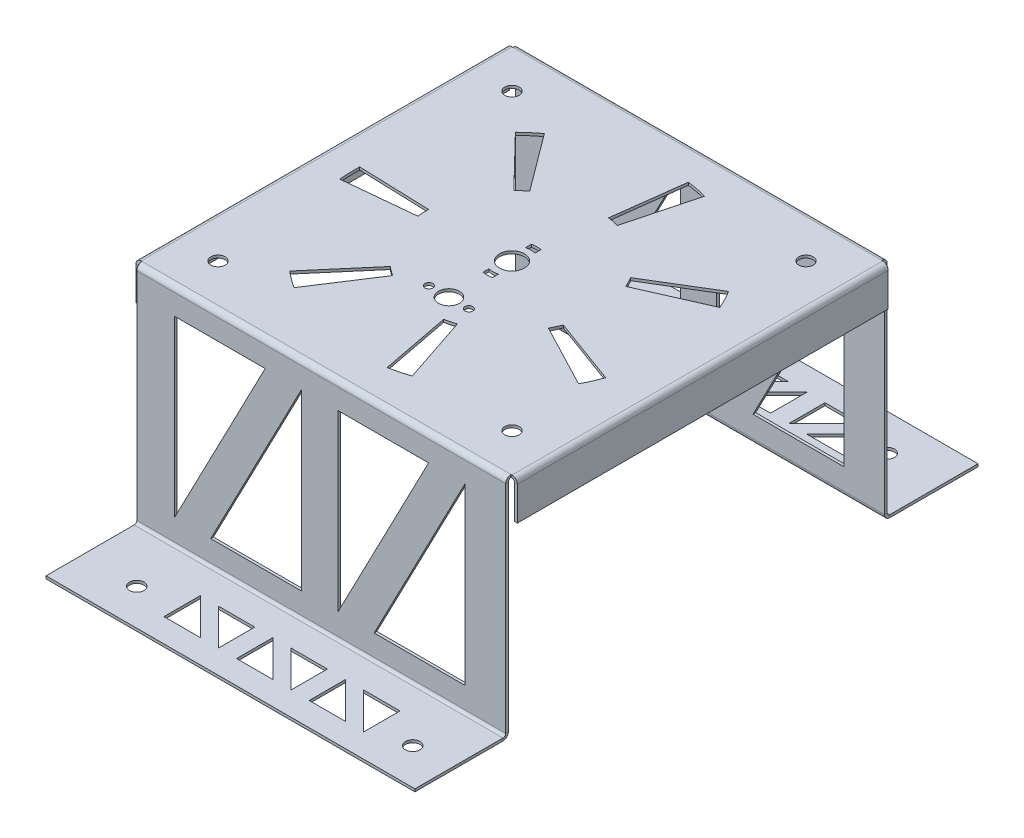
from build123d import *

# Parameters (mm, degrees)
SKETCH1_W                    = 101.6
SKETCH1_H                    = 101.6
BASE_FLANGE1_DEPTH           = 0.7366
EDGE_FLANGE3_DEPTH           = 101.6
EDGE_FLANGE3_BEND_DEPTH      = 101.6
EDGE_FLANGE4_DEPTH           = 102.1268
EDGE_FLANGE4_BEND_DEPTH      = 102.1268
EDGE_FLANGE5_DEPTH           = 101.6
EDGE_FLANGE5_BEND_DEPTH      = 101.6
F_4_0_4_DIAMETER_HOLE1_D     = 4
F_4_0_4_DIAMETER_HOLE1_DEPTH = 15
F_4_0_4_DIAMETER_HOLE1_TIP   = 1.201721238
CUT_EXTRUDE1_DEPTH           = 154.564424318
SKETCH51_R                   = 3.425
CUT_EXTRUDE2_DEPTH           = 174.86951881
CUT_EXTRUDE3_DEPTH           = 10
CUT_EXTRUDE4_DEPTH           = 10
CUT_EXTRUDE9_DEPTH           = 10
CUT_EXTRUDE9_DEPTH_BACK      = 10
SKETCH64_R                   = 1.984375
SKETCH65_R                   = 1.984375
CUT_EXTRUDE10_DEPTH          = 10
CUT_EXTRUDE11_DEPTH          = 172.799608637
CUT_EXTRUDE11_DEPTH_BACK     = 172.799608637
SKETCH66_R                   = 1.984375
CUT_EXTRUDE12_DEPTH          = 172.799608637
CUT_EXTRUDE12_DEPTH_BACK     = 172.799608637
SKETCH67_R                   = 1.984375
SKETCH68_R                   = 2.885
CUT_EXTRUDE13_DEPTH          = 10
SKETCH69_R                   = 1.075
CUT_EXTRUDE14_DEPTH          = 172.529960735
CUT_EXTRUDE20_DEPTH          = 10
CUT_EXTRUDE21_DEPTH          = 10


# Sheet-metal steps are written as plain solids
with BuildPart() as part:
    # Sketch1 → Base-Flange1 (new body)
    with BuildSketch(Plane(origin=(0, 0, 0), x_dir=(1, 0, 0), z_dir=(0, 1, 0))):
        Rectangle(SKETCH1_W, SKETCH1_H)
    extrude(amount=-BASE_FLANGE1_DEPTH)

    # Edge-Flange3 section (across the edge) → Edge-Flange3 (add)
    with BuildSketch(Plane(origin=(50.8, -0.7366, 51.8), x_dir=(0, 0, -1), z_dir=(-1, 0, 0))):
        with BuildLine():
            Line((-0.7366, 0.7366), (-0.7366, 60))
            Line((-0.7366, 60), (0, 60))
            Line((0, 60), (0, 0.7366))
            ThreePointArc((0, 0.7366), (0.215745145, 0.215745145), (0.7366, 0))
            Line((0.7366, 0), (1, 0))
            Line((1, 0), (1, -0.7366))
            Line((1, -0.7366), (0.7366, -0.7366))
            ThreePointArc((0.7366, -0.7366), (-0.30510971, -0.30510971), (-0.7366, 0.7366))
        make_face()
    extrude(amount=EDGE_FLANGE3_DEPTH)

    # Edge-Flange3 section 2 (across the edge) → Edge-Flange3 bend (add)
    with BuildSketch(Plane(origin=(-50.8, -0.7366, -51.8), x_dir=(0, 0, 1), z_dir=(1, 0, 0))):
        with BuildLine():
            Line((-0.7366, 0.7366), (-0.7366, 60))
            Line((-0.7366, 60), (0, 60))
            Line((0, 60), (0, 0.7366))
            ThreePointArc((0, 0.7366), (0.215745145, 0.215745145), (0.7366, 0))
            Line((0.7366, 0), (1, 0))
            Line((1, 0), (1, -0.7366))
            Line((1, -0.7366), (0.7366, -0.7366))
            ThreePointArc((0.7366, -0.7366), (-0.30510971, -0.30510971), (-0.7366, 0.7366))
        make_face()
    extrude(amount=EDGE_FLANGE3_BEND_DEPTH)

    # Edge-Flange4 section (across the edge) → Edge-Flange4 (add)
    with BuildSketch(Plane(origin=(51.8, -0.7366, -51.0634), x_dir=(-1, 0, 0), z_dir=(0, 0, 1))):
        with BuildLine():
            Line((-0.7366, 0.7366), (-0.7366, 10))
            Line((-0.7366, 10), (0, 10))
            Line((0, 10), (0, 0.7366))
            ThreePointArc((0, 0.7366), (0.215745145, 0.215745145), (0.7366, 0))
            Line((0.7366, 0), (1, 0))
            Line((1, 0), (1, -0.7366))
            Line((1, -0.7366), (0.7366, -0.7366))
            ThreePointArc((0.7366, -0.7366), (-0.30510971, -0.30510971), (-0.7366, 0.7366))
        make_face()
    extrude(amount=EDGE_FLANGE4_DEPTH)

    # Edge-Flange4 section 2 (across the edge) → Edge-Flange4 bend (add)
    with BuildSketch(Plane(origin=(-51.8, -0.7366, 51.0634), x_dir=(1, 0, 0), z_dir=(0, 0, -1))):
        with BuildLine():
            Line((-0.7366, 0.7366), (-0.7366, 10))
            Line((-0.7366, 10), (0, 10))
            Line((0, 10), (0, 0.7366))
            ThreePointArc((0, 0.7366), (0.215745145, 0.215745145), (0.7366, 0))
            Line((0.7366, 0), (1, 0))
            Line((1, 0), (1, -0.7366))
            Line((1, -0.7366), (0.7366, -0.7366))
            ThreePointArc((0.7366, -0.7366), (-0.30510971, -0.30510971), (-0.7366, 0.7366))
        make_face()
    extrude(amount=EDGE_FLANGE4_BEND_DEPTH)

    # Edge-Flange5 section (across the edge) → Edge-Flange5 (add)
    with BuildSketch(Plane(origin=(-50.8, -61.7366, 52.5366), x_dir=(0, 1, 0), z_dir=(1, 0, 0))):
        with BuildLine():
            Line((-0.7366, 0.7366), (-0.7366, 25))
            Line((-0.7366, 25), (0, 25))
            Line((0, 25), (0, 0.7366))
            ThreePointArc((0, 0.7366), (0.215745145, 0.215745145), (0.7366, 0))
            Line((0.7366, 0), (1, 0))
            Line((1, 0), (1, -0.7366))
            Line((1, -0.7366), (0.7366, -0.7366))
            ThreePointArc((0.7366, -0.7366), (-0.30510971, -0.30510971), (-0.7366, 0.7366))
        make_face()
    extrude(amount=EDGE_FLANGE5_DEPTH)

    # Edge-Flange5 section 2 (across the edge) → Edge-Flange5 bend (add)
    with BuildSketch(Plane(origin=(50.8, -61.7366, -52.5366), x_dir=(0, 1, 0), z_dir=(-1, 0, 0))):
        with BuildLine():
            Line((-0.7366, 0.7366), (-0.7366, 25))
            Line((-0.7366, 25), (0, 25))
            Line((0, 25), (0, 0.7366))
            ThreePointArc((0, 0.7366), (0.215745145, 0.215745145), (0.7366, 0))
            Line((0.7366, 0), (1, 0))
            Line((1, 0), (1, -0.7366))
            Line((1, -0.7366), (0.7366, -0.7366))
            ThreePointArc((0.7366, -0.7366), (-0.30510971, -0.30510971), (-0.7366, 0.7366))
        make_face()
    extrude(amount=EDGE_FLANGE5_BEND_DEPTH)

    # Ø4.0 (4) Diameter Hole1
    with Locations(Plane(origin=(0, -61.7366, 0), x_dir=(1, 0, 0), z_dir=(0, 1, 0))):
        with Locations((-35.8, 67.5366), (35.8, 67.5366), (-35.8, -67.5366), (40.197040818, -67.5366)):
            Hole(F_4_0_4_DIAMETER_HOLE1_D / 2, depth=F_4_0_4_DIAMETER_HOLE1_DEPTH)
            with Locations((0, 0, -(F_4_0_4_DIAMETER_HOLE1_DEPTH + F_4_0_4_DIAMETER_HOLE1_TIP / 2))):  # 118° drill point
                Cone(0, F_4_0_4_DIAMETER_HOLE1_D / 2, F_4_0_4_DIAMETER_HOLE1_TIP, mode=Mode.SUBTRACT)

    # Sketch50 → Cut-Extrude1 (cut, through all)
    with BuildSketch(Plane(origin=(0, 0, -52.5366), x_dir=(-1, 0, 0), z_dir=(0, 0, -1))):
        Polygon((-14.5721255, -55.172899428), (-39.5721255, -7.116778478), (-39.5721255, -55.172899428), align=None)
        Polygon((-4.5721255, -7.116778478), (-29.5721255, -7.116778478), (-4.5721255, -55.172899428), align=None)
        Polygon((30.4278745, -55.172899428), (5.4278745, -7.116778478), (5.4278745, -55.172899428), align=None)
        Polygon((40.4278745, -7.116778478), (15.4278745, -7.116778478), (40.4278745, -55.172899428), align=None)
    extrude(amount=-CUT_EXTRUDE1_DEPTH, mode=Mode.SUBTRACT)

    # Sketch51 → Cut-Extrude2 (cut, through all)
    with BuildSketch(Plane(origin=(64.672196899, 6.1634, -31.00705316), x_dir=(1, 0, 0), z_dir=(0, 1, 0))):
        with Locations(Location((-64.672196899, -31.00705316, 0), (0, 0, 90))):
            Circle(SKETCH51_R)
    extrude(amount=-CUT_EXTRUDE2_DEPTH, mode=Mode.SUBTRACT)

    # Sketch52 → Cut-Extrude3 (cut)
    with BuildSketch(Plane(origin=(64.672196899, 0.2634, -31.00705316), x_dir=(1, 0, 0), z_dir=(0, 1, 0))):
        with BuildLine():
            Line((-63.372196899, -25.97217481), (-63.372196899, -24.332474521))
            ThreePointArc((-63.372196899, -24.332474521), (-64.672196899, -24.20705316), (-65.972196899, -24.332474521))
            Line((-65.972196899, -24.332474521), (-65.972196899, -25.97217481))
            ThreePointArc((-65.972196899, -25.97217481), (-64.672196899, -25.80705316), (-63.372196899, -25.97217481))
        make_face()
    extrude(amount=-CUT_EXTRUDE3_DEPTH, mode=Mode.SUBTRACT)

    # Sketch53 → Cut-Extrude4 (cut)
    with BuildSketch(Plane(origin=(64.672196899, 0.2634, -31.00705316), x_dir=(1, 0, 0), z_dir=(0, 1, 0))):
        with BuildLine():
            Line((-65.972196899, -36.04193151), (-65.972196899, -37.681631798))
            ThreePointArc((-65.972196899, -37.681631798), (-64.672196899, -37.80705316), (-63.372196899, -37.681631798))
            Line((-63.372196899, -37.681631798), (-63.372196899, -36.04193151))
            ThreePointArc((-63.372196899, -36.04193151), (-64.672196899, -36.20705316), (-65.972196899, -36.04193151))
        make_face()
    extrude(amount=-CUT_EXTRUDE4_DEPTH, mode=Mode.SUBTRACT)

    # Sketch64 → Cut-Extrude9 (cut, two sides: drawn at the far end of the back side and taken through both)
    with BuildSketch(Plane(origin=(64.672196899, 0, -31.00705316), x_dir=(1, 0, 0), z_dir=(0, -1, 0)).offset(-CUT_EXTRUDE9_DEPTH_BACK)):
        with Locations(Location((-24.184596899, 71.49465316, 0), (0, 0, 270))):
            Circle(SKETCH64_R)
    extrude(amount=CUT_EXTRUDE9_DEPTH + CUT_EXTRUDE9_DEPTH_BACK, mode=Mode.SUBTRACT)

    # Sketch65 → Cut-Extrude10 (cut)
    with BuildSketch(Plane(origin=(64.672196899, 0.7366, -31.00705316), x_dir=(1, 0, 0), z_dir=(0, 1, 0))):
        with Locations(Location((-105.159796899, -71.49465316, 0), (0, 0, 90))):
            Circle(SKETCH65_R)
    extrude(amount=-CUT_EXTRUDE10_DEPTH, mode=Mode.SUBTRACT)

    # Sketch66 → Cut-Extrude11 (cut, two sides: drawn at the far end of the back side and taken through both)
    with BuildSketch(Plane(origin=(64.672196899, 0.7366, -31.00705316), x_dir=(1, 0, 0), z_dir=(0, 1, 0)).offset(-CUT_EXTRUDE11_DEPTH_BACK)):
        with Locations(Location((-24.184596899, 9.48054684, 0), (0, 0, 90))):
            Circle(SKETCH66_R)
    extrude(amount=CUT_EXTRUDE11_DEPTH + CUT_EXTRUDE11_DEPTH_BACK, mode=Mode.SUBTRACT)

    # Sketch67 → Cut-Extrude12 (cut, two sides: drawn at the far end of the back side and taken through both)
    with BuildSketch(Plane(origin=(64.672196899, 0.7366, -31.00705316), x_dir=(1, 0, 0), z_dir=(0, 1, 0)).offset(-CUT_EXTRUDE12_DEPTH_BACK)):
        with Locations(Location((-105.159796899, 9.48054684, 0), (0, 0, 90))):
            Circle(SKETCH67_R)
    extrude(amount=CUT_EXTRUDE12_DEPTH + CUT_EXTRUDE12_DEPTH_BACK, mode=Mode.SUBTRACT)

    # Sketch68 → Cut-Extrude13 (cut)
    with BuildSketch(Plane(origin=(64.672196899, 1.2634, -31.00705316), x_dir=(1, 0, 0), z_dir=(0, 1, 0))):
        with Locations(Location((-64.693992366, -48.358110231, 0), (0, 0, 90))):
            Circle(SKETCH68_R)
    extrude(amount=-CUT_EXTRUDE13_DEPTH, mode=Mode.SUBTRACT)

    # Sketch69 → Cut-Extrude14 (cut, through all)
    with BuildSketch(Plane(origin=(64.672196899, 0, -31.00705316), x_dir=(1, 0, 0), z_dir=(0, 1, 0))):
        with Locations(Location((-70.193992366, -48.358110231, 0), (0, 0, 270))):
            Circle(SKETCH69_R)
        with Locations(Location((-59.193992366, -48.358110231, 0), (0, 0, 270))):
            Circle(SKETCH69_R)
    extrude(amount=-CUT_EXTRUDE14_DEPTH, mode=Mode.SUBTRACT)

    # Sketch76 → Cut-Extrude20 (cut)
    with BuildSketch(Plane(origin=(0, -61.7366, 0), x_dir=(1, 0, 0), z_dir=(0, 1, 0))):
        Polygon((-14.82683684, -71.019535924), (-24.82683684, -61.019535924), (-24.82683684, -71.019535924), align=None)
        Polygon((5.17316316, -71.019535924), (-4.82683684, -61.019535924), (-4.82683684, -71.019535924), align=None)
        Polygon((-9.82683684, -61.019535924), (-19.82683684, -61.019535924), (-9.82683684, -71.019535924), align=None)
        Polygon((10.17316316, -61.019535924), (0.17316316, -61.019535924), (10.17316316, -71.019535924), align=None)
        Polygon((25.17316316, -71.019535924), (15.17316316, -61.019535924), (15.17316316, -71.019535924), (23.950368631, -71.019535924), align=None)
        Polygon((23.950368631, -61.019535924), (20.17316316, -61.019535924), (30.17316316, -71.019535924), (30.17316316, -61.019535924), align=None)
        Polygon((0.17316316, 61.019535924), (10.17316316, 61.019535924), (10.17316316, 71.019535924), align=None)
        Polygon((-4.82683684, 61.019535924), (5.17316316, 71.019535924), (-4.82683684, 71.019535924), align=None)
        Polygon((-24.82683684, 61.019535924), (-14.82683684, 71.019535924), (-24.82683684, 71.019535924), align=None)
        Polygon((-19.82683684, 61.019535924), (-9.82683684, 61.019535924), (-9.82683684, 71.019535924), align=None)
        Polygon((15.17316316, 61.019535924), (25.17316316, 71.019535924), (23.950368631, 71.019535924), (15.17316316, 71.019535924), align=None)
        Polygon((30.17316316, 61.019535924), (30.17316316, 71.019535924), (20.17316316, 61.019535924), (23.950368631, 61.019535924), align=None)
    extrude(amount=-CUT_EXTRUDE20_DEPTH, mode=Mode.SUBTRACT)

    # Sketch77 → Cut-Extrude21 (cut)
    with BuildSketch(Plane(origin=(0, 0, 0), x_dir=(1, 0, 0), z_dir=(0, 1, 0))):
        with BuildLine():
            Line((37.106652541, 22.538432261), (20.313924527, 12.338596466))
            ThreePointArc((20.313924527, 12.338596466), (21.075415037, 10.987418872), (21.747158244, 9.58945258))
            Line((21.747158244, 9.58945258), (39.724684593, 17.516678496))
            ThreePointArc((39.724684593, 17.516678496), (38.497637514, 20.070288922), (37.106652541, 22.538432261))
        make_face()
        with BuildLine():
            Line((5.514363533, 43.06363183), (3.018821612, 23.575054794))
            ThreePointArc((3.018821612, 23.575054794), (4.549996361, 23.327966598), (6.061795458, 22.981538858))
            Line((6.061795458, 22.981538858), (11.072845009, 41.979479451))
            ThreePointArc((11.072845009, 41.979479451), (8.311300644, 42.612285473), (5.514363533, 43.06363183))
        make_face()
        with BuildLine():
            Line((-30.230353688, 31.161038293), (-16.54951555, 17.059016018))
            ThreePointArc((-16.54951555, 17.059016018), (-15.401662379, 18.102079672), (-14.188222946, 19.068057638))
            Line((-14.188222946, 19.068057638), (-25.917072712, 34.830876154))
            ThreePointArc((-25.917072712, 34.830876154), (-28.13361513, 33.06636193), (-30.230353688, 31.161038293))
        make_face()
        with BuildLine():
            ThreePointArc((-23.655729954, -2.30280976), (-23.75555521, -0.755042462), (-23.754220084, 0.795940099))
            Line((-23.754220084, 0.795940099), (-43.390906069, 1.453912692))
            ThreePointArc((-43.390906069, 1.453912692), (-43.393344891, -1.379206577), (-43.210997995, -4.206452648))
            Line((-43.210997995, -4.206452648), (-23.655729954, -2.30280976))
        make_face()
        with BuildLine():
            ThreePointArc((-12.948697214, -19.93057282), (-14.221030443, -19.043602222), (-15.432805001, -18.075536569))
            Line((-15.432805001, -18.075536569), (-28.190502143, -33.017876681))
            ThreePointArc((-28.190502143, -33.017876681), (-25.977000886, -34.7862044), (-23.652879468, -36.406398949))
            Line((-23.652879468, -36.406398949), (-12.948697214, -19.93057282))
        make_face()
        with BuildLine():
            ThreePointArc((7.508968634, -22.550208037), (6.022220303, -22.99194109), (4.50982702, -23.335765527))
            Line((4.50982702, -23.335765527), (8.237924878, -42.626531472))
            ThreePointArc((8.237924878, -42.626531472), (11.000554621, -41.998480801), (13.716339729, -41.191584287))
            Line((13.716339729, -41.191584287), (7.508968634, -22.550208037))
        make_face()
        with BuildLine():
            ThreePointArc((22.312227945, -8.189076662), (21.730616331, -9.626879367), (21.056467311, -11.02368708))
            Line((21.056467311, -11.02368708), (38.463026443, -20.136538641))
            ThreePointArc((38.463026443, -20.136538641), (39.694468127, -17.585044546), (40.756875348, -14.958666501))
            Line((40.756875348, -14.958666501), (22.312227945, -8.189076662))
        make_face()
    extrude(amount=-CUT_EXTRUDE21_DEPTH, mode=Mode.SUBTRACT)


solid = part.part
